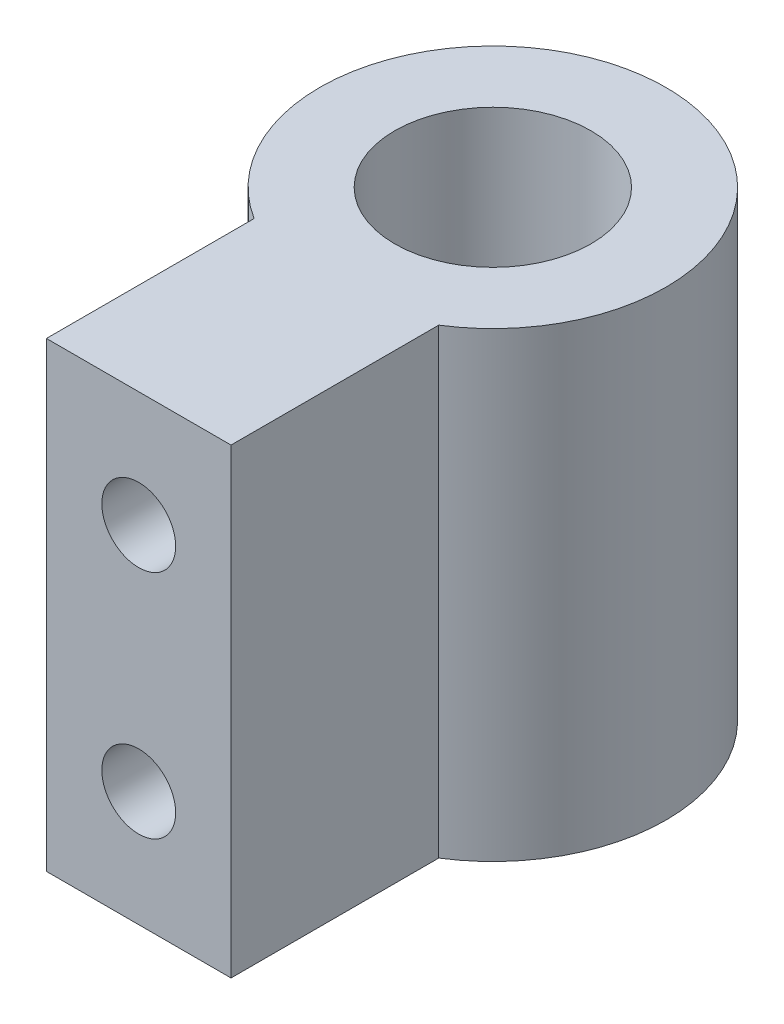
from build123d import *

# Parameters (mm, degrees)
SKETCH1_R           = 5.3975
BOSS_EXTRUDE1_DEPTH = 25.4
SKETCH4_R           = 2.032
CUT_EXTRUDE2_DEPTH  = 12.7


with BuildPart() as part:
    # Sketch1 → Boss-Extrude1 (new body)
    with BuildSketch(Plane(origin=(0, 0, 0), x_dir=(1, 0, 0), z_dir=(0, 1, 0))):
        with BuildLine():
            Line((-5.08, -8.057246738), (-5.08, -19.487246738))
            Line((-5.08, -19.487246738), (5.08, -19.487246738))
            Line((5.08, -19.487246738), (5.08, -8.057246738))
            ThreePointArc((5.08, -8.057246738), (0, 9.525), (-5.08, -8.057246738))
        make_face()
        Circle(SKETCH1_R, mode=Mode.SUBTRACT)
    extrude(amount=BOSS_EXTRUDE1_DEPTH)

    # Sketch4 → Cut-Extrude2 (cut)
    with BuildSketch(Plane.XY.offset(19.487246738)):
        with Locations((0, 19.05)):
            Circle(SKETCH4_R)
        with Locations((0, 6.35)):
            Circle(SKETCH4_R)
    extrude(amount=-CUT_EXTRUDE2_DEPTH, mode=Mode.SUBTRACT)


solid = part.part
